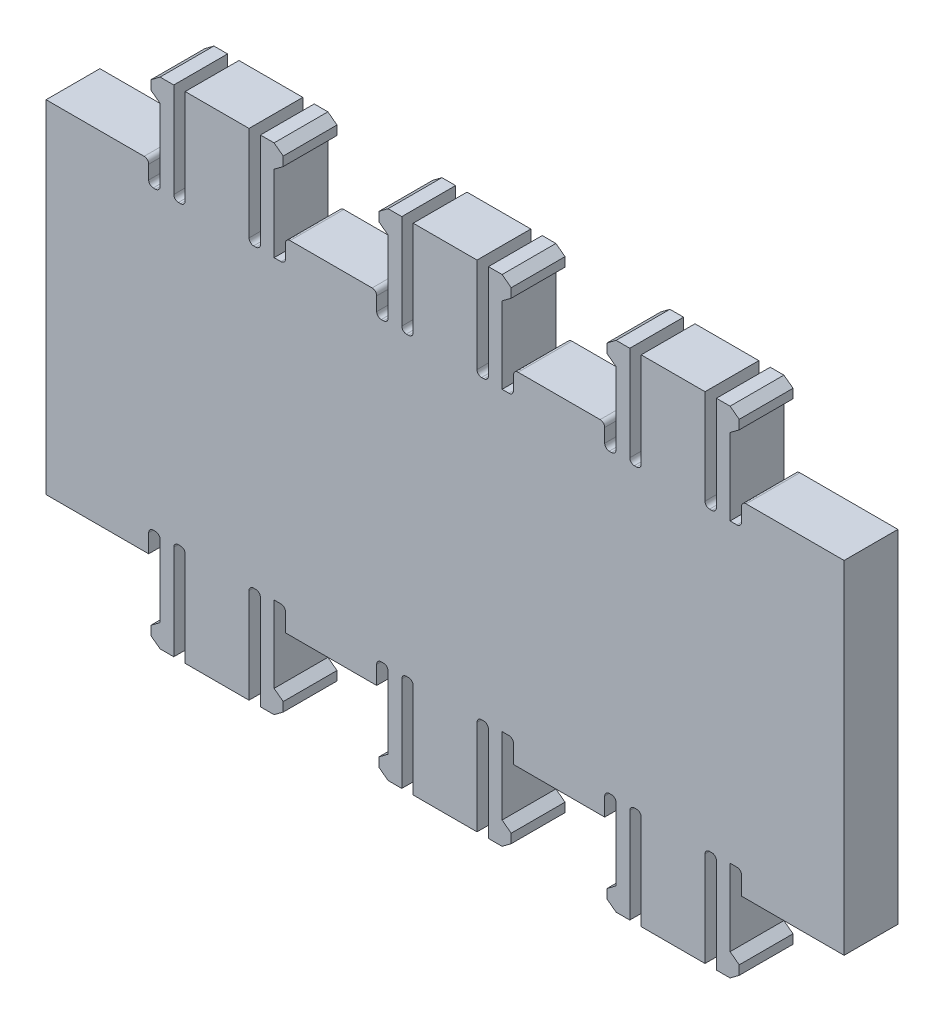
from build123d import *

# Parameters (mm, degrees)
SKETCH1_W                = 44.45
SKETCH1_H                = 19.05
BODY_DEPTH               = 2.9972
SKETCH2_W                = 6.35
SKETCH2_H                = 2.9972
TAB_DEPTH                = 4.2672
SKETCH3_W                = 0.635
SKETCH3_H                = 5.5372
SKETCH3_H_2              = 1.27
SLOTS_DEPTH              = 27.327905608
FILLET1_R                = 0.254
RETAINER_DEPTH           = 2.9972
TAB_PATTERN_COUNT        = 3
TAB_PATTERN_PITCH        = 12.7
TAB_PATTERN_COPY_1_DEPTH = 2.9972
TAB_PATTERN_COPY_2_DEPTH = 2.9972
FILLET1_OF_TAB_PATTERN_R = 0.254
TAB_MIRROR_DEPTH         = 2.9972
TAB_MIRROR_2_OUTLINE_W   = 3.556
TAB_MIRROR_2_OUTLINE_H   = 4.2672
TAB_MIRROR_2_DEPTH       = 2.9972


# Read off the part's stored shape, not the designer's step: Tab Mirror
with BuildPart() as part:
    # Sketch1 → Body (new body)
    with BuildSketch(Plane.XY):
        Rectangle(SKETCH1_W, SKETCH1_H)
    extrude(amount=BODY_DEPTH)

    # Sketch2 → Tab (add)
    with BuildSketch(Plane(origin=(0, 9.525, 0), x_dir=(1, 0, 0), z_dir=(0, 1, 0))):
        with Locations((-12.7, -1.4986)):
            Rectangle(SKETCH2_W, SKETCH2_H)
    tab = extrude(amount=TAB_DEPTH)

    # Sketch3 → Slots (cut, through all)
    with BuildSketch(Plane.XY.offset(2.9972)):
        with Locations((-14.7955, 11.0236)):
            Rectangle(SKETCH3_W, SKETCH3_H)
        with Locations((-10.6045, 11.0236)):
            Rectangle(SKETCH3_W, SKETCH3_H)
        with Locations((-9.2075, 8.89)):
            Rectangle(SKETCH3_W, SKETCH3_H_2)
        with Locations((-16.1925, 8.89)):
            Rectangle(SKETCH3_W, SKETCH3_H_2)
    slots = extrude(amount=-SLOTS_DEPTH, mode=Mode.SUBTRACT)

    # Fillet1
    fillet1_edges = [part.edges().sort_by_distance(p)[0] for p in [
        (-15.875, 8.255, 1.4986),
        (-16.51, 8.255, 1.4986),
        (-16.51, 9.525, 1.4986),
        (-8.89, 9.525, 1.4986),
        (-8.89, 8.255, 1.4986),
        (-10.287, 8.255, 1.4986),
        (-10.922, 8.255, 1.4986),
        (-14.478, 8.255, 1.4986),
        (-15.113, 8.255, 1.4986),
    ]]
    fillet(fillet1_edges, radius=FILLET1_R)

    # Sketch5 → Retainer (add)
    with BuildSketch(Plane.XY.offset(2.9972)):
        Polygon((-15.875, 13.7922), (-16.383, 13.4112), (-16.383, 12.9032), (-15.875, 12.5222), align=None)
    retainer = extrude(amount=-RETAINER_DEPTH)

    # Retainer Mirror: Retainer across plane
    add(retainer.mirror(Plane.ZY.offset(12.7)))

    # Tab Pattern: Tab, Slots, Retainer ×3
    with Locations(*[(i * TAB_PATTERN_PITCH, 0, 0) for i in range(1, TAB_PATTERN_COUNT)]):
        add(tab)
        add(slots, mode=Mode.SUBTRACT)
        add(retainer)

    # Tab Pattern copy 1 sketch → Tab Pattern copy 1 (add)
    with BuildSketch(Plane(origin=(-12.7, 0, 2.9972), x_dir=(-1, 0, 0), z_dir=(0, 0, 1))):
        Polygon((-15.875, -13.7922), (-16.383, -13.4112), (-16.383, -12.9032), (-15.875, -12.5222), align=None)
    extrude(amount=-TAB_PATTERN_COPY_1_DEPTH)

    # Tab Pattern copy 2 sketch → Tab Pattern copy 2 (add)
    with BuildSketch(Plane(origin=(0, 0, 2.9972), x_dir=(-1, 0, 0), z_dir=(0, 0, 1))):
        Polygon((-15.875, -13.7922), (-16.383, -13.4112), (-16.383, -12.9032), (-15.875, -12.5222), align=None)
    extrude(amount=-TAB_PATTERN_COPY_2_DEPTH)

    # Fillet1 of Tab Pattern
    fillet1_of_tab_pattern_edges = [part.edges().sort_by_distance(p)[0] for p in [
        (-3.175, 8.255, 1.4986),
        (-3.81, 8.255, 1.4986),
        (-3.81, 9.525, 1.4986),
        (3.81, 9.525, 1.4986),
        (3.81, 8.255, 1.4986),
        (2.413, 8.255, 1.4986),
        (1.778, 8.255, 1.4986),
        (-1.778, 8.255, 1.4986),
        (-2.413, 8.255, 1.4986),
        (9.525, 8.255, 1.4986),
        (8.89, 8.255, 1.4986),
        (8.89, 9.525, 1.4986),
        (16.51, 9.525, 1.4986),
        (16.51, 8.255, 1.4986),
        (15.113, 8.255, 1.4986),
        (14.478, 8.255, 1.4986),
        (10.922, 8.255, 1.4986),
        (10.287, 8.255, 1.4986),
    ]]
    fillet(fillet1_of_tab_pattern_edges, radius=FILLET1_OF_TAB_PATTERN_R)

    # Tab Mirror outline → Tab Mirror (cut)
    with BuildSketch(Plane.XY):
        with BuildLine():
            Line((15.875, -8.255), (15.875, -9.525))
            Line((15.875, -9.525), (16.51, -9.525))
            Line((16.51, -9.525), (16.51, -8.509))
            ThreePointArc((16.51, -8.509), (16.435605122, -8.329394878), (16.256, -8.255))
            Line((16.256, -8.255), (15.875, -8.255))
        make_face()
        with BuildLine():
            Line((14.478, -8.509), (14.478, -9.525))
            Line((14.478, -9.525), (15.113, -9.525))
            Line((15.113, -9.525), (15.113, -8.509))
            ThreePointArc((15.113, -8.509), (15.038605122, -8.329394878), (14.859, -8.255))
            Line((14.859, -8.255), (14.732, -8.255))
            ThreePointArc((14.732, -8.255), (14.552394878, -8.329394878), (14.478, -8.509))
        make_face()
        with BuildLine():
            Line((10.287, -8.509), (10.287, -9.525))
            Line((10.287, -9.525), (10.922, -9.525))
            Line((10.922, -9.525), (10.922, -8.509))
            ThreePointArc((10.922, -8.509), (10.847605122, -8.329394878), (10.668, -8.255))
            Line((10.668, -8.255), (10.541, -8.255))
            ThreePointArc((10.541, -8.255), (10.361394878, -8.329394878), (10.287, -8.509))
        make_face()
        with BuildLine():
            Line((-16.51, -9.525), (-15.875, -9.525))
            Line((-15.875, -9.525), (-15.875, -8.509))
            ThreePointArc((-15.875, -8.509), (-15.949394878, -8.329394878), (-16.129, -8.255))
            Line((-16.129, -8.255), (-16.256, -8.255))
            ThreePointArc((-16.256, -8.255), (-16.435605122, -8.329394878), (-16.51, -8.509))
            Line((-16.51, -8.509), (-16.51, -9.525))
        make_face()
        with BuildLine():
            Line((-15.113, -9.525), (-14.478, -9.525))
            Line((-14.478, -9.525), (-14.478, -8.509))
            ThreePointArc((-14.478, -8.509), (-14.552394878, -8.329394878), (-14.732, -8.255))
            Line((-14.732, -8.255), (-14.859, -8.255))
            ThreePointArc((-14.859, -8.255), (-15.038605122, -8.329394878), (-15.113, -8.509))
            Line((-15.113, -8.509), (-15.113, -9.525))
        make_face()
        with BuildLine():
            Line((-10.922, -9.525), (-10.287, -9.525))
            Line((-10.287, -9.525), (-10.287, -8.509))
            ThreePointArc((-10.287, -8.509), (-10.361394878, -8.329394878), (-10.541, -8.255))
            Line((-10.541, -8.255), (-10.668, -8.255))
            ThreePointArc((-10.668, -8.255), (-10.847605122, -8.329394878), (-10.922, -8.509))
            Line((-10.922, -8.509), (-10.922, -9.525))
        make_face()
        with BuildLine():
            Line((-9.525, -9.525), (-8.89, -9.525))
            Line((-8.89, -9.525), (-8.89, -8.509))
            ThreePointArc((-8.89, -8.509), (-8.964394878, -8.329394878), (-9.144, -8.255))
            Line((-9.144, -8.255), (-9.525, -8.255))
            Line((-9.525, -8.255), (-9.525, -9.525))
        make_face()
        with BuildLine():
            Line((-3.81, -9.525), (-3.175, -9.525))
            Line((-3.175, -9.525), (-3.175, -8.509))
            ThreePointArc((-3.175, -8.509), (-3.249394878, -8.329394878), (-3.429, -8.255))
            Line((-3.429, -8.255), (-3.556, -8.255))
            ThreePointArc((-3.556, -8.255), (-3.735605122, -8.329394878), (-3.81, -8.509))
            Line((-3.81, -8.509), (-3.81, -9.525))
        make_face()
        with BuildLine():
            Line((-2.413, -9.525), (-1.778, -9.525))
            Line((-1.778, -9.525), (-1.778, -8.509))
            ThreePointArc((-1.778, -8.509), (-1.852394878, -8.329394878), (-2.032, -8.255))
            Line((-2.032, -8.255), (-2.159, -8.255))
            ThreePointArc((-2.159, -8.255), (-2.338605122, -8.329394878), (-2.413, -8.509))
            Line((-2.413, -8.509), (-2.413, -9.525))
        make_face()
        with BuildLine():
            Line((1.778, -9.525), (2.413, -9.525))
            Line((2.413, -9.525), (2.413, -8.509))
            ThreePointArc((2.413, -8.509), (2.338605122, -8.329394878), (2.159, -8.255))
            Line((2.159, -8.255), (2.032, -8.255))
            ThreePointArc((2.032, -8.255), (1.852394878, -8.329394878), (1.778, -8.509))
            Line((1.778, -8.509), (1.778, -9.525))
        make_face()
        with BuildLine():
            Line((3.175, -9.525), (3.81, -9.525))
            Line((3.81, -9.525), (3.81, -8.509))
            ThreePointArc((3.81, -8.509), (3.735605122, -8.329394878), (3.556, -8.255))
            Line((3.556, -8.255), (3.175, -8.255))
            Line((3.175, -8.255), (3.175, -9.525))
        make_face()
        with BuildLine():
            Line((9.525, -9.525), (9.525, -8.509))
            ThreePointArc((9.525, -8.509), (9.450605122, -8.329394878), (9.271, -8.255))
            Line((9.271, -8.255), (9.144, -8.255))
            ThreePointArc((9.144, -8.255), (8.964394878, -8.329394878), (8.89, -8.509))
            Line((8.89, -8.509), (8.89, -9.525))
            Line((8.89, -9.525), (9.525, -9.525))
        make_face()
    extrude(amount=TAB_MIRROR_DEPTH, mode=Mode.SUBTRACT)

    # Tab Mirror 2 outline → Tab Mirror 2 (add)
    with BuildSketch(Plane.XY):
        Polygon((15.875, -9.525), (15.113, -9.525), (15.113, -13.7922), (15.875, -13.7922), (16.383, -13.4112), (16.383, -12.9032), (15.875, -12.5222), align=None)
        with Locations((12.7, -11.6586)):
            Rectangle(TAB_MIRROR_2_OUTLINE_W, TAB_MIRROR_2_OUTLINE_H)
        Polygon((10.287, -9.525), (9.525, -9.525), (9.525, -12.5222), (9.017, -12.9032), (9.017, -13.4112), (9.525, -13.7922), (10.287, -13.7922), align=None)
        Polygon((-15.113, -13.7922), (-15.113, -9.525), (-15.875, -9.525), (-15.875, -12.5222), (-16.383, -12.9032), (-16.383, -13.4112), (-15.875, -13.7922), align=None)
        with Locations((-12.7, -11.6586)):
            Rectangle(TAB_MIRROR_2_OUTLINE_W, TAB_MIRROR_2_OUTLINE_H)
        Polygon((-9.525, -12.5222), (-9.525, -9.525), (-10.287, -9.525), (-10.287, -13.7922), (-9.525, -13.7922), (-9.017, -13.4112), (-9.017, -12.9032), align=None)
        Polygon((-2.413, -13.7922), (-2.413, -9.525), (-3.175, -9.525), (-3.175, -12.5222), (-3.683, -12.9032), (-3.683, -13.4112), (-3.175, -13.7922), align=None)
        with Locations((0, -11.6586)):
            Rectangle(TAB_MIRROR_2_OUTLINE_W, TAB_MIRROR_2_OUTLINE_H)
        Polygon((3.175, -12.5222), (3.175, -9.525), (2.413, -9.525), (2.413, -13.7922), (3.175, -13.7922), (3.683, -13.4112), (3.683, -12.9032), align=None)
    extrude(amount=TAB_MIRROR_2_DEPTH)


solid = part.part
